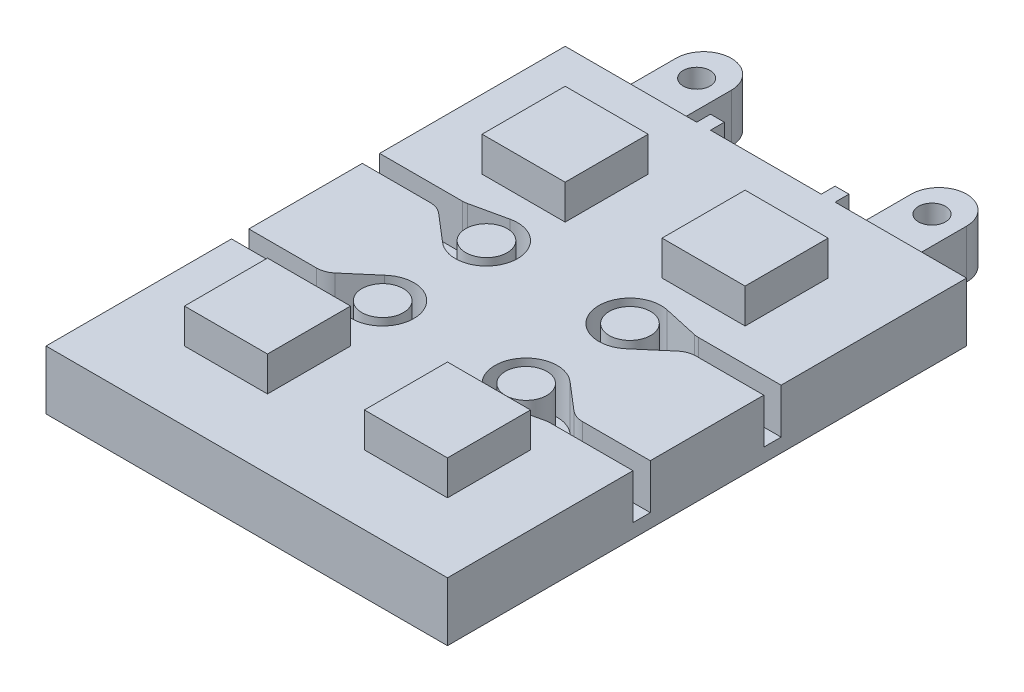
from build123d import *

# Parameters (mm, degrees)
SKETCH1_W           = 58
SKETCH1_H           = 75
BOSS_EXTRUDE1_DEPTH = 8.5
SKETCH4_R           = 3
CUT_EXTRUDE1_DEPTH  = 6.5
SKETCH5_W           = 12
SKETCH5_H           = 12
BOSS_EXTRUDE2_DEPTH = 5
SKETCH8_W           = 2
SKETCH8_H           = 8.5
BOSS_EXTRUDE3_DEPTH = 2
SKETCH7_W           = 8
SKETCH7_H           = 7
BOSS_EXTRUDE4_DEPTH = 12
SKETCH9_R           = 1.95
CUT_EXTRUDE2_DEPTH  = 7
FILLET1_R           = 4


with BuildPart() as part:
    # Sketch1 → Boss-Extrude1 (new body)
    with BuildSketch(Plane(origin=(0, 0, 0), x_dir=(1, 0, 0), z_dir=(0, 1, 0))):
        with Locations((-28.734265734, -3.094405594)):
            Rectangle(SKETCH1_W, SKETCH1_H)
    extrude(amount=BOSS_EXTRUDE1_DEPTH)

    # Sketch4 → Cut-Extrude1 (cut)
    # profile 1 of 4: a face of its own
    with BuildSketch(Plane(origin=(0, 8.5, 0), x_dir=(1, 0, 0), z_dir=(0, 1, 0))):
        with BuildLine():
            Line((-57.734265734, 7.605594406), (-57.734265734, 5.105594406))
            Line((-57.734265734, 5.105594406), (-47.937319909, 5.105594406))
            ThreePointArc((-47.937319909, 5.105594406), (-46.897035131, 4.919454313), (-45.985842823, 4.384132793))
            Line((-45.985842823, 4.384132793), (-42.13114507, 1.082738189))
            ThreePointArc((-42.13114507, 1.082738189), (-34.749045592, 3.244128144), (-40.069670138, 8.799121725))
            Line((-40.069670138, 8.799121725), (-45.137956932, 7.676576192))
            ThreePointArc((-45.137956932, 7.676576192), (-45.46038672, 7.623392649), (-45.786688237, 7.605594406))
            Line((-45.786688237, 7.605594406), (-57.734265734, 7.605594406))
        make_face()
        with Locations(Location((-39.096573179, 4.405594406, 0), (0, 0, 270))):
            Circle(SKETCH4_R, mode=Mode.SUBTRACT)
    # profile 2 of 4: a face of its own
    with BuildSketch(Plane(origin=(0, 8.5, 0), x_dir=(1, 0, 0), z_dir=(0, 1, 0))):
        with BuildLine():
            Line((-57.734265734, -13.794405594), (-57.734265734, -11.294405594))
            Line((-57.734265734, -11.294405594), (-47.937319909, -11.294405594))
            ThreePointArc((-47.937319909, -11.294405594), (-46.897035131, -11.108265502), (-45.985842823, -10.572943982))
            Line((-45.985842823, -10.572943982), (-42.13114507, -7.271549377))
            ThreePointArc((-42.13114507, -7.271549377), (-34.749045592, -9.432939333), (-40.069670138, -14.987932914))
            Line((-40.069670138, -14.987932914), (-45.137956932, -13.865387381))
            ThreePointArc((-45.137956932, -13.865387381), (-45.46038672, -13.812203837), (-45.786688237, -13.794405594))
            Line((-45.786688237, -13.794405594), (-57.734265734, -13.794405594))
        make_face()
        with Locations(Location((-39.096573179, -10.594405594, 0), (0, 0, 270))):
            Circle(SKETCH4_R, mode=Mode.SUBTRACT)
    # profile 3 of 4: a face of its own
    with BuildSketch(Plane(origin=(0, 8.5, 0), x_dir=(1, 0, 0), z_dir=(0, 1, 0))):
        with BuildLine():
            Line((0.265734266, -13.794405594), (0.265734266, -11.294405594))
            Line((0.265734266, -11.294405594), (-9.531211559, -11.294405594))
            ThreePointArc((-9.531211559, -11.294405594), (-10.571496337, -11.108265502), (-11.482688645, -10.572943982))
            Line((-11.482688645, -10.572943982), (-15.337386398, -7.271549377))
            ThreePointArc((-15.337386398, -7.271549377), (-22.719485877, -9.432939333), (-17.39886133, -14.987932914))
            Line((-17.39886133, -14.987932914), (-12.330574537, -13.865387381))
            ThreePointArc((-12.330574537, -13.865387381), (-12.008144749, -13.812203837), (-11.681843231, -13.794405594))
            Line((-11.681843231, -13.794405594), (0.265734266, -13.794405594))
        make_face()
        with Locations(Location((-18.371958289, -10.594405594, 0), (0, 0, 270))):
            Circle(SKETCH4_R, mode=Mode.SUBTRACT)
    # profile 4 of 4: a face of its own
    with BuildSketch(Plane(origin=(0, 8.5, 0), x_dir=(1, 0, 0), z_dir=(0, 1, 0))):
        with BuildLine():
            Line((0.265734266, 7.605594406), (0.265734266, 5.105594406))
            Line((0.265734266, 5.105594406), (-9.531211559, 5.105594406))
            ThreePointArc((-9.531211559, 5.105594406), (-10.571496337, 4.919454313), (-11.482688645, 4.384132793))
            Line((-11.482688645, 4.384132793), (-15.337386398, 1.082738189))
            ThreePointArc((-15.337386398, 1.082738189), (-22.719485877, 3.244128144), (-17.39886133, 8.799121725))
            Line((-17.39886133, 8.799121725), (-12.330574537, 7.676576192))
            ThreePointArc((-12.330574537, 7.676576192), (-12.008144749, 7.623392649), (-11.681843231, 7.605594406))
            Line((-11.681843231, 7.605594406), (0.265734266, 7.605594406))
        make_face()
        with Locations(Location((-18.371958289, 4.405594406, 0), (0, 0, 270))):
            Circle(SKETCH4_R, mode=Mode.SUBTRACT)
    extrude(amount=-CUT_EXTRUDE1_DEPTH, mode=Mode.SUBTRACT)

    # Sketch5 → Boss-Extrude2 (add)
    with BuildSketch(Plane(origin=(0, 8.5, 0), x_dir=(1, 0, 0), z_dir=(0, 1, 0))):
        with Locations((-41.734265734, 18.405594406)):
            Rectangle(SKETCH5_W, SKETCH5_H)
        with Locations((-15.734265734, 18.405594406)):
            Rectangle(SKETCH5_W, SKETCH5_H)
        with Locations((-15.734265734, -24.594405594)):
            Rectangle(SKETCH5_W, SKETCH5_H)
        with Locations((-41.734265734, -24.594405594)):
            Rectangle(SKETCH5_W, SKETCH5_H)
    extrude(amount=BOSS_EXTRUDE2_DEPTH)

    # Sketch8 → Boss-Extrude3 (add)
    with BuildSketch(Plane(origin=(0, 0, -34.405594406), x_dir=(-1, 0, 0), z_dir=(0, 0, -1))):
        with Locations((37.734265734, 4.25)):
            Rectangle(SKETCH8_W, SKETCH8_H)
        with Locations((19.734265734, 4.25)):
            Rectangle(SKETCH8_W, SKETCH8_H)
    extrude(amount=BOSS_EXTRUDE3_DEPTH)

    # Sketch7 → Boss-Extrude4 (add)
    with BuildSketch(Plane(origin=(0, 0, -34.405594406), x_dir=(-1, 0, 0), z_dir=(0, 0, -1))):
        with Locations((45.734265734, 3.5)):
            Rectangle(SKETCH7_W, SKETCH7_H)
        with Locations((11.734265734, 3.5)):
            Rectangle(SKETCH7_W, SKETCH7_H)
    extrude(amount=BOSS_EXTRUDE4_DEPTH)

    # Sketch9 → Cut-Extrude2 (cut)
    with BuildSketch(Plane(origin=(0, 0, 0), x_dir=(-1, 0, 0), z_dir=(0, -1, 0))):
        with Locations(Location((11.734265734, 41.405594406, 0), (0, 0, 90))):
            Circle(SKETCH9_R)
        with Locations(Location((45.734265734, 41.405594406, 0), (0, 0, 90))):
            Circle(SKETCH9_R)
    extrude(amount=-CUT_EXTRUDE2_DEPTH, mode=Mode.SUBTRACT)

    # Fillet1
    fillet1_edges = [part.edges().sort_by_distance(p)[0] for p in [
        (-7.734265734, 3.5, -46.405594406),
        (-15.734265734, 3.5, -46.405594406),
        (-49.734265734, 3.5, -46.405594406),
        (-41.734265734, 3.5, -46.405594406),
    ]]
    fillet(fillet1_edges, radius=FILLET1_R - 0.0001)  # a hair under: the kernel refuses the full size


solid = part.part
